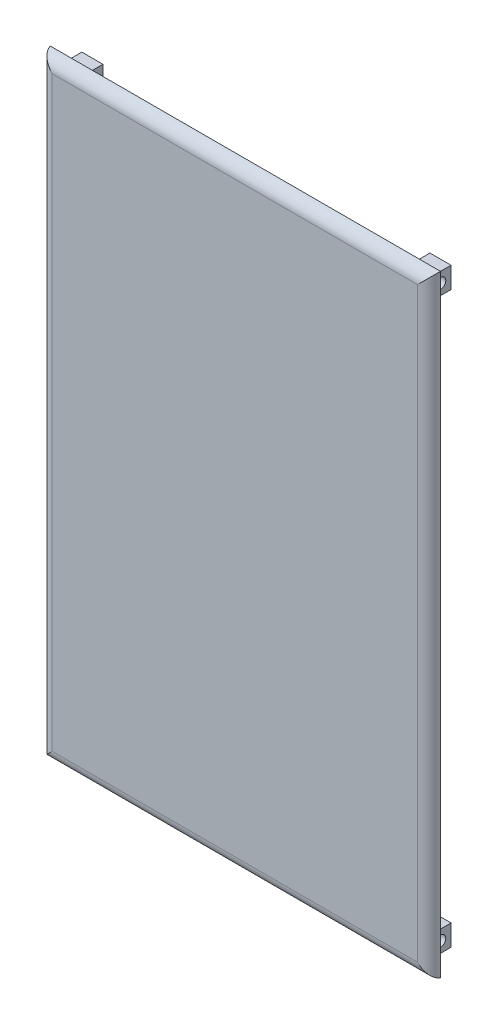
from build123d import *

# Parameters (mm, degrees)
SKETCH3_W           = 117.475
SKETCH3_H           = 184.15
BOSS_EXTRUDE2_DEPTH = 3.175
FILLET1_R           = 3.81
SKETCH13_W          = 111.125
SKETCH13_H          = 177.8
SKETCH13_W_2        = 107.95
SKETCH13_H_2        = 174.625
BOSS_EXTRUDE4_DEPTH = 3.175
SKETCH14_W          = 6.35
SKETCH14_H          = 6.35
BOSS_EXTRUDE5_DEPTH = 6.35
FILLET9_R           = 0.381
SKETCH15_R          = 1.5875
CUT_EXTRUDE9_DEPTH  = 6.35
CUT_EXTRUDE10_START = -6.35
SKETCH16_R          = 1.5875
CUT_EXTRUDE10_DEPTH = 6.35
SKETCH17_W          = 1.5875
SKETCH17_H          = 57.15
BOSS_EXTRUDE6_DEPTH = 4.7625
SKETCH18_W          = 1.5875
SKETCH18_H          = 57.15
BOSS_EXTRUDE7_DEPTH = 4.7625


with BuildPart() as part:
    # Sketch3 → Boss-Extrude2 (new body)
    with BuildSketch(Plane.XY):
        with Locations((58.7375, 92.075)):
            Rectangle(SKETCH3_W, SKETCH3_H)
    extrude(amount=BOSS_EXTRUDE2_DEPTH)

    # Fillet1
    # the kernel refuses this fillet: 3.81 mm, written as the material it takes off along each edge
    with BuildSketch(Plane(origin=(126.866776656, 0, 3.175), x_dir=(0, 0, -1), z_dir=(-1, 0, 0)), Plane(origin=(-9.391776656, 184.15, 3.175), x_dir=(0, 0, -1), z_dir=(1, 0, 0))) as fillet1_piece_1:
        with BuildLine():
            CenterArc((3.81, -3.756710662), FILLET1_R, 99.594068227, 80.405931773)
            Line((0, -3.756710662), (-0.0762, -3.756710662))
            Line((-0.0762, -3.756710662), (-0.0762, 0))
            Line((-0.0762, 0), (0, 0.0762))
            ThreePointArc((0, 0.0762), (1.5875, 0.0762), (3.1623, 0.075134213))
            Line((3.1623, 0.075134213), (3.175, 0))
        make_face()
    extrude(amount=136.258553311, mode=Mode.SUBTRACT)
    with BuildSketch(Plane(origin=(117.475, 193.541776656, 3.175), x_dir=(0, 0, -1), z_dir=(0, -1, 0)), Plane(origin=(0, -9.391776656, 3.175), x_dir=(0, 0, -1), z_dir=(0, 1, 0))) as fillet1_piece_2:
        with BuildLine():
            CenterArc((3.81, -3.756710662), FILLET1_R, 99.594068227, 80.405931773)
            Line((0, -3.756710662), (-0.0762, -3.756710662))
            Line((-0.0762, -3.756710662), (-0.0762, 0))
            Line((-0.0762, 0), (0, 0.0762))
            ThreePointArc((0, 0.0762), (1.5875, 0.0762), (3.1623, 0.075134213))
            Line((3.1623, 0.075134213), (3.175, 0))
        make_face()
    extrude(amount=202.933553311, mode=Mode.SUBTRACT)

    # Sketch13 → Boss-Extrude4 (add)
    with BuildSketch(Plane(origin=(0, 0, 0), x_dir=(-1, 0, 0), z_dir=(0, 0, -1))):
        with Locations((-58.7375, 92.075)):
            Rectangle(SKETCH13_W, SKETCH13_H)
        with Locations((-58.7375, 92.075)):
            Rectangle(SKETCH13_W_2, SKETCH13_H_2, mode=Mode.SUBTRACT)
    extrude(amount=BOSS_EXTRUDE4_DEPTH)

    # Sketch14 → Boss-Extrude5 (add)
    with BuildSketch(Plane(origin=(0, 0, 0), x_dir=(-1, 0, 0), z_dir=(0, 0, -1))):
        with Locations((-111.125, 177.8)):
            Rectangle(SKETCH14_W, SKETCH14_H)
        with Locations((-6.35, 177.8)):
            Rectangle(SKETCH14_W, SKETCH14_H)
        with Locations((-111.125, 6.35)):
            Rectangle(SKETCH14_W, SKETCH14_H)
        with Locations((-6.35, 6.35)):
            Rectangle(SKETCH14_W, SKETCH14_H)
    extrude(amount=BOSS_EXTRUDE5_DEPTH)

    # Fillet9
    fillet9_edges = [part.edges().sort_by_distance(p)[0] for p in [
        (107.95, 7.14375, 0),
        (110.33125, 9.525, 0),
        (4.7625, 92.075, 0),
        (9.525, 4.7625, -1.5875),
        (4.7625, 9.525, -1.5875),
        (7.14375, 9.525, 0),
        (9.525, 7.14375, 0),
        (112.7125, 92.075, 0),
        (110.33125, 174.625, 0),
        (112.7125, 174.625, -1.5875),
        (107.95, 179.3875, -1.5875),
        (107.95, 177.00625, 0),
        (4.7625, 174.625, -1.5875),
        (58.7375, 179.3875, 0),
        (9.525, 179.3875, -1.5875),
        (9.525, 177.00625, 0),
        (7.14375, 174.625, 0),
        (58.7375, 4.7625, 0),
        (107.95, 4.7625, -1.5875),
        (112.7125, 9.525, -1.5875),
    ]]
    fillet(fillet9_edges, radius=FILLET9_R)

    # Sketch15 → Cut-Extrude9 (cut)
    with BuildSketch(Plane(origin=(114.3, 0, 0), x_dir=(0, 0, -1), z_dir=(1, 0, 0))):
        with Locations(Location((3.175, 6.35, 0), (0, 0, 90))):
            Circle(SKETCH15_R)
        with Locations(Location((3.175, 177.8, 0), (0, 0, 90))):
            Circle(SKETCH15_R)
    extrude(amount=-CUT_EXTRUDE9_DEPTH, mode=Mode.SUBTRACT)

    # Sketch16 → Cut-Extrude10 (cut)
    with BuildSketch(Plane.ZY.offset(-3.175).offset(CUT_EXTRUDE10_START)):
        with Locations(Location((-3.175, 177.8, 0), (0, 0, 90))):
            Circle(SKETCH16_R)
        with Locations(Location((-3.175, 6.35, 0), (0, 0, 90))):
            Circle(SKETCH16_R)
    extrude(amount=CUT_EXTRUDE10_DEPTH, mode=Mode.SUBTRACT)

    # Sketch17 → Boss-Extrude6 (add)
    with BuildSketch(Plane(origin=(0, 0, 0), x_dir=(-1, 0, 0), z_dir=(0, 0, -1))):
        with Locations((-102.52075, 149.225)):
            Rectangle(SKETCH17_W, SKETCH17_H)
        with Locations((-14.95425, 149.225)):
            Rectangle(SKETCH17_W, SKETCH17_H)
    extrude(amount=BOSS_EXTRUDE6_DEPTH)

    # Sketch18 → Boss-Extrude7 (add)
    with BuildSketch(Plane(origin=(0, 0, 0), x_dir=(-1, 0, 0), z_dir=(0, 0, -1))):
        with Locations((-102.52075, 91.821)):
            Rectangle(SKETCH18_W, SKETCH18_H)
        with Locations((-14.95425, 91.821)):
            Rectangle(SKETCH18_W, SKETCH18_H)
    extrude(amount=BOSS_EXTRUDE7_DEPTH)


solid = part.part
